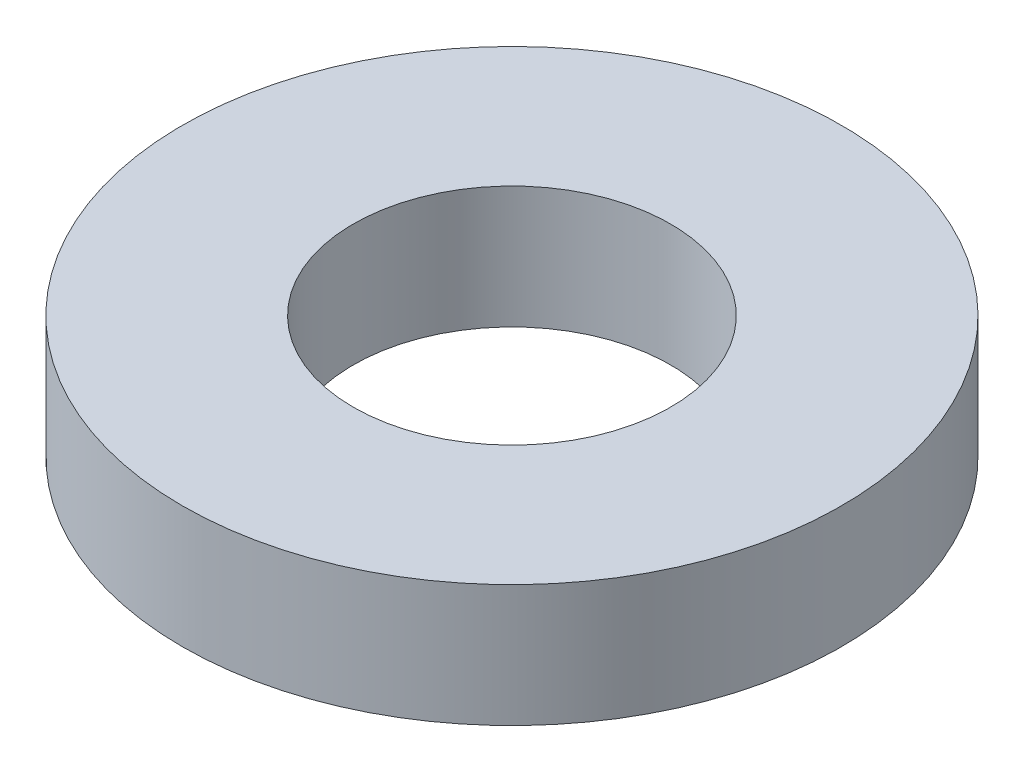
from build123d import *

# Parameters (mm, degrees)
SKETCH1_R           = 67.5
BOSS_EXTRUDE1_DEPTH = 25
SKETCH2_R           = 32.5
CUT_EXTRUDE1_DEPTH  = 99.67877178


with BuildPart() as part:
    # Sketch1 → Boss-Extrude1 (new body)
    with BuildSketch(Plane(origin=(0, 0, 0), x_dir=(1, 0, 0), z_dir=(0, 1, 0))):
        Circle(SKETCH1_R)
    extrude(amount=BOSS_EXTRUDE1_DEPTH)

    # Sketch2 → Cut-Extrude1 (cut, through all)
    with BuildSketch(Plane(origin=(0, 0, 0), x_dir=(1, 0, 0), z_dir=(0, 1, 0))):
        Circle(SKETCH2_R)
    extrude(amount=CUT_EXTRUDE1_DEPTH, mode=Mode.SUBTRACT)


solid = part.part
